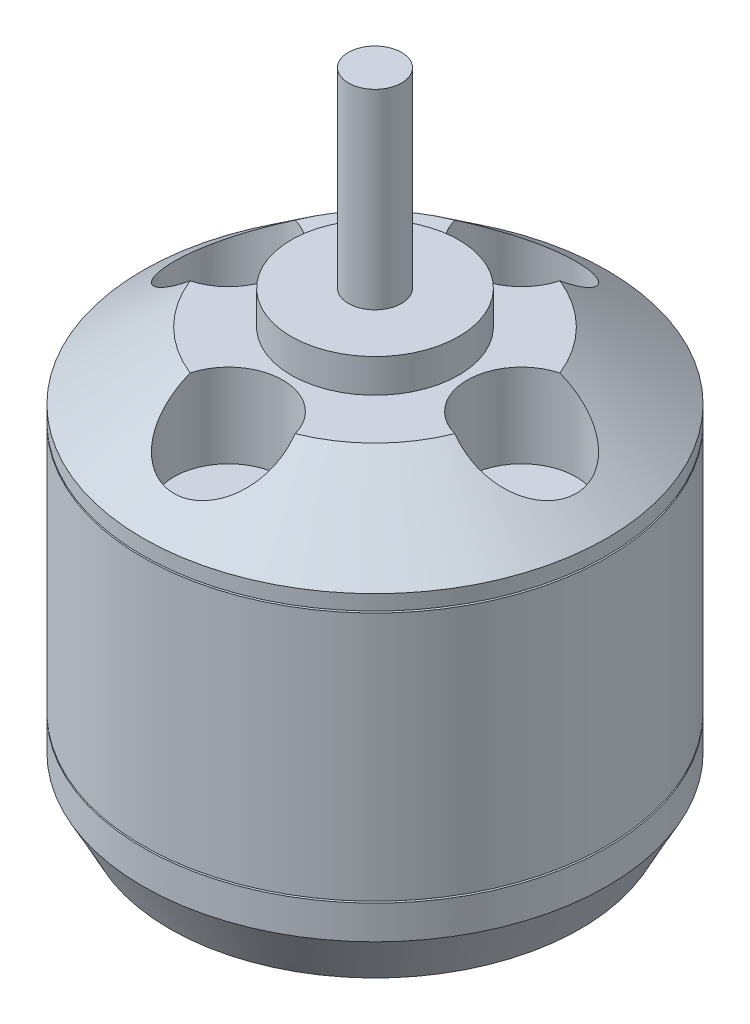
from build123d import *
from build123d.topology import SkipClean

# Parameters (mm, degrees)
SKETCH1_R           = 13.85
BOSS_EXTRUDE1_DEPTH = 25
SKETCH6_R           = 1.5
CUT_EXTRUDE1_DEPTH  = 4
SKETCH7_R           = 5
CUT_EXTRUDE2_DEPTH  = 1
CHAMFER1_SIZE       = 1
SKETCH8_R           = 5
BOSS_EXTRUDE2_DEPTH = 2
SKETCH9_R           = 1.585
BOSS_EXTRUDE3_DEPTH = 40
SKETCH10_R          = 3.25
CUT_EXTRUDE3_DEPTH  = 5
THREAD1_PITCH       = 0.5
THREAD2_PITCH       = 0.5
THREAD3_PITCH       = 0.5
THREAD4_PITCH       = 0.5
SKETCH22_W          = 0.2
SKETCH22_H          = 0.1


with BuildPart() as part:
    # Sketch1 → Boss-Extrude1 (new body)
    with BuildSketch(Plane(origin=(0, 0, 0), x_dir=(1, 0, 0), z_dir=(0, 1, 0))):
        with Locations(Location((0, 0, 0), (0, 0, 270))):
            Circle(SKETCH1_R)
    extrude(amount=BOSS_EXTRUDE1_DEPTH)

    # Sketch4 → Cut-Revolve1 (revolve, cut)
    with BuildSketch(Plane(origin=(0, 0, 0), x_dir=(0, 0, -1), z_dir=(1, 0, 0)), mode=Mode.PRIVATE) as cut_revolve1_sk:
        Polygon((13.85, 3), (12.25, 0), (13.85, 0), align=None)
    revolve(cut_revolve1_sk.sketch.rotate(Axis((0, 9.462394443, 0), (0, -1, 0)), 180), axis=Axis((0, 9.462394443, 0), (0, -1, 0)), mode=Mode.SUBTRACT)

    # Sketch5 → Cut-Revolve2 (revolve, cut)
    with BuildSketch(Plane(origin=(0, 0, 0), x_dir=(0, 0, -1), z_dir=(1, 0, 0))):
        Polygon((-8.5, 25), (-13.85, 21), (-13.85, 25), align=None)
    revolve(axis=Axis((0, 28.201215648, 0), (0, -1, 0)), mode=Mode.SUBTRACT)

    # Sketch6 → Cut-Extrude1 (cut)
    with BuildSketch(Plane.XZ):
        with Locations(Location((0, 9.5, 0), (0, 0, 270))):
            Circle(SKETCH6_R)
        with Locations(Location((0, -9.5, 0), (0, 0, 270))):
            Circle(SKETCH6_R)
        with Locations(Location((8, 0, 0), (0, 0, 270))):
            Circle(SKETCH6_R)
        with Locations(Location((-8, 0, 0), (0, 0, 270))):
            Circle(SKETCH6_R)
    extrude(amount=-CUT_EXTRUDE1_DEPTH, mode=Mode.SUBTRACT)

    # Sketch7 → Cut-Extrude2 (cut)
    with BuildSketch(Plane(origin=(0, 0, 0), x_dir=(-1, 0, 0), z_dir=(0, -1, 0))):
        with Locations(Location((0, 0, 0), (0, 0, 90))):
            Circle(SKETCH7_R)
    extrude(amount=-CUT_EXTRUDE2_DEPTH, mode=Mode.SUBTRACT)

    # Chamfer1
    chamfer1_edges = [part.edges().sort_by_distance(p)[0] for p in [
        (0, 1, 5),
    ]]
    chamfer(chamfer1_edges, length=CHAMFER1_SIZE - 0.0001)  # a hair under: the kernel refuses the full size

    # Sketch8 → Boss-Extrude2 (add)
    with BuildSketch(Plane(origin=(0, 25, 0), x_dir=(1, 0, 0), z_dir=(0, 1, 0))):
        with Locations(Location((0, 0, 0), (0, 0, 270))):
            Circle(SKETCH8_R)
    extrude(amount=BOSS_EXTRUDE2_DEPTH)

    # Sketch9 → Boss-Extrude3 (add)
    with BuildSketch(Plane(origin=(0, 38.4, 0), x_dir=(1, 0, 0), z_dir=(0, 1, 0))):
        with Locations(Location((0, 0, 0), (0, 0, 270))):
            Circle(SKETCH9_R)
    extrude(amount=-BOSS_EXTRUDE3_DEPTH)

    # Sketch10 → Cut-Extrude3 (cut)
    with BuildSketch(Plane(origin=(0, 25, 0), x_dir=(1, 0, 0), z_dir=(0, 1, 0))):
        with Locations(Location((8.75, 0, 0), (0, 0, 270))):
            Circle(SKETCH10_R)
        with Locations(Location((0, -8.75, 0), (0, 0, 270))):
            Circle(SKETCH10_R)
        with Locations(Location((-8.75, 0, 0), (0, 0, 270))):
            Circle(SKETCH10_R)
        with Locations(Location((0, 8.75, 0), (0, 0, 270))):
            Circle(SKETCH10_R)
    extrude(amount=-CUT_EXTRUDE3_DEPTH, mode=Mode.SUBTRACT)

    # Thread1: the profile of Thread Profile1 profile screwed along a right-hand helix of 8 turns, 6 arcs to a turn; built about Z, then put on its axis
    with SkipClean():  # the faces are left unmerged after this step: merging them gives an invalid solid
        thread1_z = Axis((0, 0, 0), (0, 0, 1))
        thread1_corners = [(1.4997, 0, -0.000173205), (1.770632937, 0, 0.156249999), (1.770632937, 0, 0.218749999), (1.4997, 0, 0.375173204)]
        with BuildLine(mode=Mode.PRIVATE) as thread1_profile:
            Line(thread1_corners[0], thread1_corners[1])
            Line(thread1_corners[1], thread1_corners[2])
            Line(thread1_corners[2], thread1_corners[3])
            Line(thread1_corners[3], thread1_corners[0])
        thread1_cap = Face(thread1_profile.wire())
        thread1_turn_angles = [0, 30, 60, 90, 120, 150, 180, 210, 240, 270, 300, 330, 360]
        thread1_turn_weights = [1, 0.8660254037844387, 1, 0.8660254037844387, 1, 0.8660254037844387, 1, 0.8660254037844387, 1, 0.8660254037844387, 1, 0.8660254037844387, 1]
        thread1_turn_rails = [Edge.make_bspline([Vector(p[0], p[1], 0).rotate(thread1_z, thread1_turn_angles[k]) / thread1_turn_weights[k] + Vector(0, 0, p[2] + THREAD1_PITCH * thread1_turn_angles[k] / 360) for k in range(13)], [0, 0, 0, 1, 1, 2, 2, 3, 3, 4, 4, 5, 5, 6, 6, 6], 2, thread1_turn_weights) for p in thread1_corners]
        thread1_turn_sides = [Face.make_surface_from_curves(thread1_turn_rails[p[0]], thread1_turn_rails[p[1]]) for p in [(0, 1), (1, 2), (2, 3), (3, 0)]]
        thread1 = Plane(origin=(-8, 0, 0), x_dir=(1, 0, 0), z_dir=(0, 1, 0)) * Solid(Shell([*[p.moved(Location((0, 0, THREAD1_PITCH * i))) for i in range(8) for p in thread1_turn_sides], thread1_cap, thread1_cap.rotate(thread1_z, 2880).moved(Location((0, 0, THREAD1_PITCH * 2880 / 360)))]))
        add(thread1, mode=Mode.SUBTRACT)

    # Thread2: the profile of Thread Profile2 profile screwed along a right-hand helix of 8 turns, 6 arcs to a turn; built about Z, then put on its axis
    with SkipClean():  # the faces are left unmerged after this step: merging them gives an invalid solid
        thread2_z = Axis((0, 0, 0), (0, 0, 1))
        thread2_corners = [(1.4997, 0, -0.000173205), (1.770632938, 0, 0.156249999), (1.770632937, 0, 0.218749999), (1.4997, 0, 0.375173204)]
        with BuildLine(mode=Mode.PRIVATE) as thread2_profile:
            Line(thread2_corners[0], thread2_corners[1])
            Line(thread2_corners[1], thread2_corners[2])
            Line(thread2_corners[2], thread2_corners[3])
            Line(thread2_corners[3], thread2_corners[0])
        thread2_cap = Face(thread2_profile.wire())
        thread2_turn_angles = [0, 30, 60, 90, 120, 150, 180, 210, 240, 270, 300, 330, 360]
        thread2_turn_weights = [1, 0.8660254037844387, 1, 0.8660254037844387, 1, 0.8660254037844387, 1, 0.8660254037844387, 1, 0.8660254037844387, 1, 0.8660254037844387, 1]
        thread2_turn_rails = [Edge.make_bspline([Vector(p[0], p[1], 0).rotate(thread2_z, thread2_turn_angles[k]) / thread2_turn_weights[k] + Vector(0, 0, p[2] + THREAD2_PITCH * thread2_turn_angles[k] / 360) for k in range(13)], [0, 0, 0, 1, 1, 2, 2, 3, 3, 4, 4, 5, 5, 6, 6, 6], 2, thread2_turn_weights) for p in thread2_corners]
        thread2_turn_sides = [Face.make_surface_from_curves(thread2_turn_rails[p[0]], thread2_turn_rails[p[1]]) for p in [(0, 1), (1, 2), (2, 3), (3, 0)]]
        thread2 = Plane(origin=(0, 0, 9.5), x_dir=(1, 0, 0), z_dir=(0, 1, 0)) * Solid(Shell([*[p.moved(Location((0, 0, THREAD2_PITCH * i))) for i in range(8) for p in thread2_turn_sides], thread2_cap, thread2_cap.rotate(thread2_z, 2880).moved(Location((0, 0, THREAD2_PITCH * 2880 / 360)))]))
        add(thread2, mode=Mode.SUBTRACT)

    # Thread3: the profile of Thread Profile3 profile screwed along a right-hand helix of 8 turns, 6 arcs to a turn; built about Z, then put on its axis
    with SkipClean():  # the faces are left unmerged after this step: merging them gives an invalid solid
        thread3_z = Axis((0, 0, 0), (0, 0, 1))
        thread3_corners = [(1.4997, 0, -0.000173205), (1.770632938, 0, 0.156249999), (1.770632938, 0, 0.218749999), (1.4997, 0, 0.375173204)]
        with BuildLine(mode=Mode.PRIVATE) as thread3_profile:
            Line(thread3_corners[0], thread3_corners[1])
            Line(thread3_corners[1], thread3_corners[2])
            Line(thread3_corners[2], thread3_corners[3])
            Line(thread3_corners[3], thread3_corners[0])
        thread3_cap = Face(thread3_profile.wire())
        thread3_turn_angles = [0, 30, 60, 90, 120, 150, 180, 210, 240, 270, 300, 330, 360]
        thread3_turn_weights = [1, 0.8660254037844387, 1, 0.8660254037844387, 1, 0.8660254037844387, 1, 0.8660254037844387, 1, 0.8660254037844387, 1, 0.8660254037844387, 1]
        thread3_turn_rails = [Edge.make_bspline([Vector(p[0], p[1], 0).rotate(thread3_z, thread3_turn_angles[k]) / thread3_turn_weights[k] + Vector(0, 0, p[2] + THREAD3_PITCH * thread3_turn_angles[k] / 360) for k in range(13)], [0, 0, 0, 1, 1, 2, 2, 3, 3, 4, 4, 5, 5, 6, 6, 6], 2, thread3_turn_weights) for p in thread3_corners]
        thread3_turn_sides = [Face.make_surface_from_curves(thread3_turn_rails[p[0]], thread3_turn_rails[p[1]]) for p in [(0, 1), (1, 2), (2, 3), (3, 0)]]
        thread3 = Plane(origin=(8, 0, 0), x_dir=(1, 0, 0), z_dir=(0, 1, 0)) * Solid(Shell([*[p.moved(Location((0, 0, THREAD3_PITCH * i))) for i in range(8) for p in thread3_turn_sides], thread3_cap, thread3_cap.rotate(thread3_z, 2880).moved(Location((0, 0, THREAD3_PITCH * 2880 / 360)))]))
        add(thread3, mode=Mode.SUBTRACT)

    # Thread4: the profile of Thread Profile4 profile screwed along a right-hand helix of 8 turns, 6 arcs to a turn; built about Z, then put on its axis
    with SkipClean():  # the faces are left unmerged after this step: merging them gives an invalid solid
        thread4_z = Axis((0, 0, 0), (0, 0, 1))
        thread4_corners = [(1.4997, 0, -0.000173205), (1.770632938, 0, 0.156249999), (1.770632937, 0, 0.218749999), (1.4997, 0, 0.375173204)]
        with BuildLine(mode=Mode.PRIVATE) as thread4_profile:
            Line(thread4_corners[0], thread4_corners[1])
            Line(thread4_corners[1], thread4_corners[2])
            Line(thread4_corners[2], thread4_corners[3])
            Line(thread4_corners[3], thread4_corners[0])
        thread4_cap = Face(thread4_profile.wire())
        thread4_turn_angles = [0, 30, 60, 90, 120, 150, 180, 210, 240, 270, 300, 330, 360]
        thread4_turn_weights = [1, 0.8660254037844387, 1, 0.8660254037844387, 1, 0.8660254037844387, 1, 0.8660254037844387, 1, 0.8660254037844387, 1, 0.8660254037844387, 1]
        thread4_turn_rails = [Edge.make_bspline([Vector(p[0], p[1], 0).rotate(thread4_z, thread4_turn_angles[k]) / thread4_turn_weights[k] + Vector(0, 0, p[2] + THREAD4_PITCH * thread4_turn_angles[k] / 360) for k in range(13)], [0, 0, 0, 1, 1, 2, 2, 3, 3, 4, 4, 5, 5, 6, 6, 6], 2, thread4_turn_weights) for p in thread4_corners]
        thread4_turn_sides = [Face.make_surface_from_curves(thread4_turn_rails[p[0]], thread4_turn_rails[p[1]]) for p in [(0, 1), (1, 2), (2, 3), (3, 0)]]
        thread4 = Plane(origin=(0, 0, -9.5), x_dir=(1, 0, 0), z_dir=(0, 1, 0)) * Solid(Shell([*[p.moved(Location((0, 0, THREAD4_PITCH * i))) for i in range(8) for p in thread4_turn_sides], thread4_cap, thread4_cap.rotate(thread4_z, 2880).moved(Location((0, 0, THREAD4_PITCH * 2880 / 360)))]))
        add(thread4, mode=Mode.SUBTRACT)

    # Sketch22 → Cut-Revolve3 (revolve, cut)
    with SkipClean():  # the faces are left unmerged after this step: merging them gives an invalid solid
        with BuildSketch(Plane(origin=(0, 0, 0), x_dir=(0, 0, -1), z_dir=(1, 0, 0))):
            with Locations((13.75, 5.05)):
                Rectangle(SKETCH22_W, SKETCH22_H)
            with Locations((13.75, 20.05)):
                Rectangle(SKETCH22_W, SKETCH22_H)
        revolve(axis=Axis((0, 15.598399477, 0), (0, 1, 0)), mode=Mode.SUBTRACT)


solid = part.part
